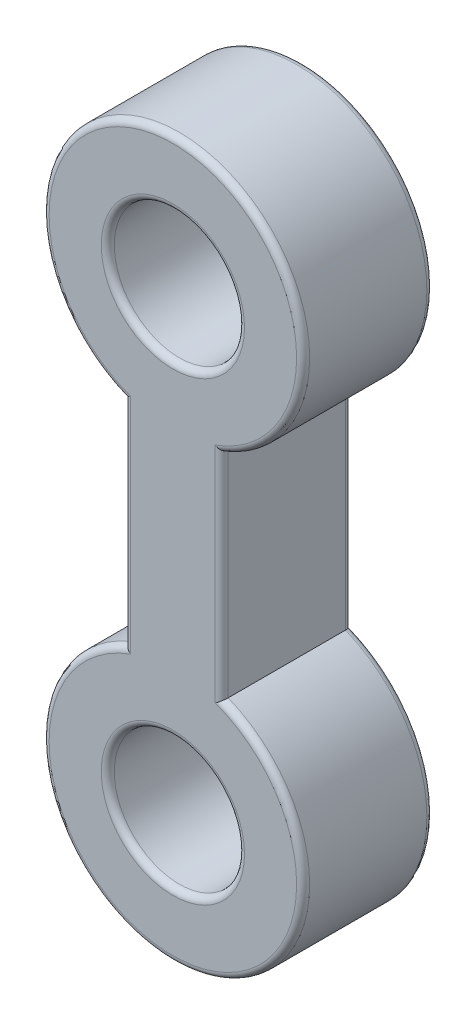
from build123d import *

# Parameters (mm, degrees)
SKETCH1_R           = 254
BOSS_EXTRUDE1_DEPTH = 254
FILLET1_R           = 25.4


with BuildPart() as part:
    # Sketch1 → Boss-Extrude1 (new, symmetric)
    with BuildSketch(Plane.XY):
        with BuildLine():
            Line((190.5, -470.928603931), (190.5, -1307.071396069))
            ThreePointArc((190.5, -1307.071396069), (0, -2286), (-190.5, -1307.071396069))
            Line((-190.5, -1307.071396069), (-190.5, -470.928603931))
            ThreePointArc((-190.5, -470.928603931), (0, 508), (190.5, -470.928603931))
        make_face()
        Circle(SKETCH1_R, mode=Mode.SUBTRACT)
        with Locations(Location((0, -1778, 0), (0, 0, 180))):
            Circle(SKETCH1_R, mode=Mode.SUBTRACT)
    extrude(amount=BOSS_EXTRUDE1_DEPTH, both=True)

    # Fillet1
    fillet1_edges = [part.edges().sort_by_distance(p)[0] for p in [
        (0, -2286, 254),
        (-254, 0, -254),
        (-254, 0, 254),
        (190.5, -889, 254),
        (254, -1778, -254),
        (254, -1778, 254),
        (0, 508, 254),
        (190.5, -889, -254),
        (0, -2286, -254),
        (-190.5, -889, -254),
        (0, 508, -254),
        (-190.5, -889, 254),
    ]]
    fillet(fillet1_edges, radius=FILLET1_R - 0.0001)  # a hair under: the kernel refuses the full size


solid = part.part
